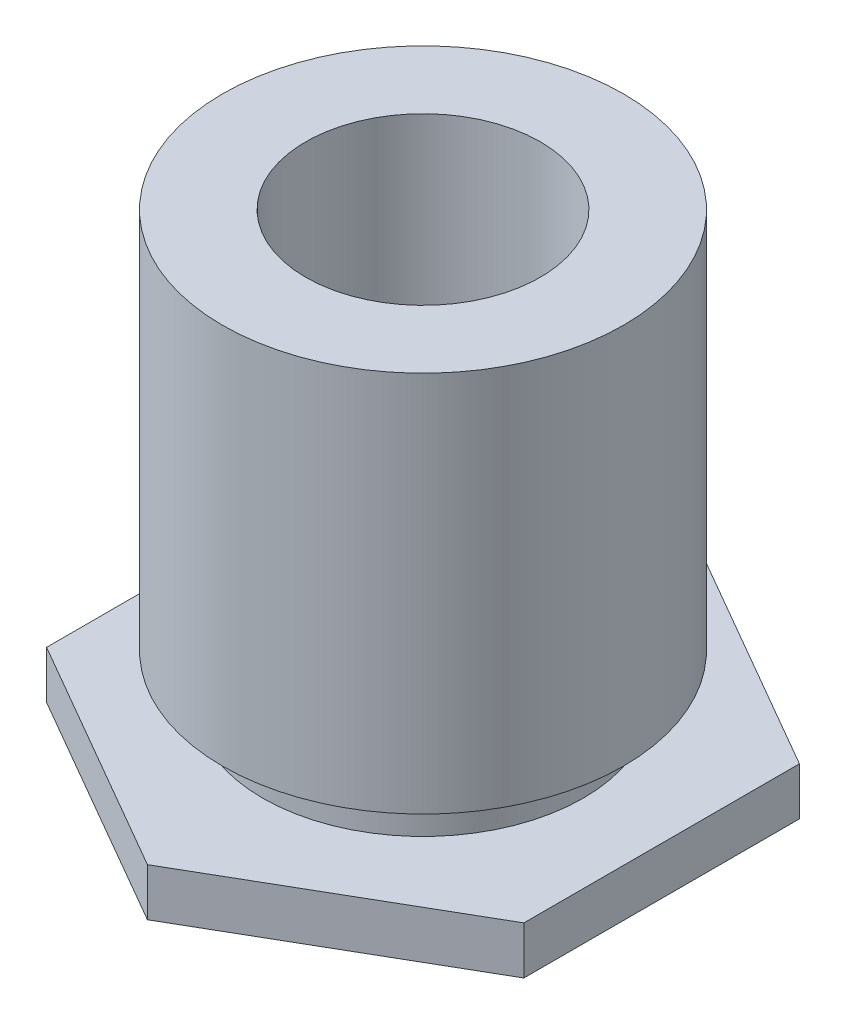
from build123d import *

# Parameters (mm, degrees)
EXTRUDE_1_DEPTH = 0.5


with BuildPart() as part:
    # Эскиз1 → Бобышка-Вытянуть1 (new body)
    with BuildSketch(Plane(origin=(0, 0, 0), x_dir=(1, 0, 0), z_dir=(0, 1, 0))):
        Polygon((0, -2.886751346), (2.5, -1.443375673), (2.5, 1.443375673), (0, 2.886751346), (-2.5, 1.443375673), (-2.5, -1.443375673), align=None)
    extrude(amount=EXTRUDE_1_DEPTH)

    # Эскиз6 → Повернуть1 (revolve)
    with BuildSketch(Plane.XY):
        Polygon((2.1, 5), (2.1, 1), (1.68, 1), (1.68, 0.5), (0, 0.5), (0, 1.8), (1.2295, 1.8), (1.2295, 5), align=None)
    revolve(axis=Axis((0, 1.8, 0), (0, -1, 0)))


solid = part.part
